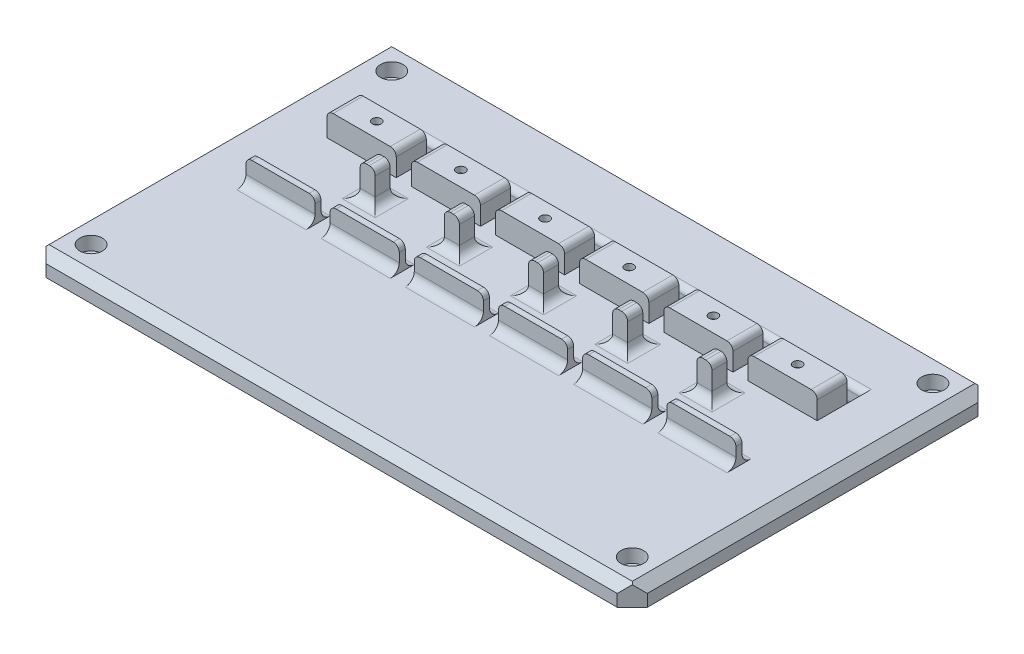
from build123d import *

# Parameters (mm, degrees)
SKETCH1_W           = 200
SKETCH1_H           = 120
BOSS_EXTRUDE1_DEPTH = 7
CHAMFER1_SIZE       = 5
SKETCH14_R          = 1.5
CUT_EXTRUDE13_DEPTH = 144.661892362
SKETCH16_R          = 3.75
CUT_EXTRUDE14_DEPTH = 4.5
SKETCH17_W          = 23
SKETCH17_H          = 10
SKETCH17_H_2        = 2
BOSS_EXTRUDE2_DEPTH = 8
FILLET1_R           = 3
SKETCH18_W          = 79
SKETCH18_H          = 6
CUT_EXTRUDE15_DEPTH = 144.714088791
SKETCH22_R          = 3.1
SKETCH22_R_2        = 3.5
CUT_EXTRUDE17_DEPTH = 13
SKETCH23_R          = 1.5
CUT_EXTRUDE18_DEPTH = 145.078934328
SKETCH24_W          = 5
SKETCH24_H          = 5
BOSS_EXTRUDE3_DEPTH = 11
FILLET2_R           = 3
FILLET3_R           = 3
FILLET4_R           = 2
FILLET5_R           = 2
FILLET6_R           = 2
FILLET7_R           = 2
CHAMFER2_SIZE       = 3


with BuildPart() as part:
    # Sketch1 → Boss-Extrude1 (new body)
    with BuildSketch(Plane(origin=(0, 0, 0), x_dir=(1, 0, 0), z_dir=(0, 1, 0))):
        with Locations((-11.182432432, 30.709459459)):
            Rectangle(SKETCH1_W, SKETCH1_H)
    extrude(amount=BOSS_EXTRUDE1_DEPTH)

    # Chamfer1
    chamfer1_edges = [part.edges().sort_by_distance(p)[0] for p in [
        (-111.182432432, 3.5, -90.709459459),
        (88.817567568, 3.5, -90.709459459),
        (88.817567568, 3.5, 29.290540541),
        (-111.182432432, 3.5, 29.290540541),
    ]]
    chamfer(chamfer1_edges, length=CHAMFER1_SIZE)

    # Sketch14 → Cut-Extrude13 (cut, through all)
    with BuildSketch(Plane.XZ):
        with Locations(Location((-101.182432432, 19.290540541, 0), (0, 0, 270))):
            Circle(SKETCH14_R)
        with Locations(Location((-101.182432432, -80.709459459, 0), (0, 0, 270))):
            Circle(SKETCH14_R)
        with Locations(Location((78.817567568, 19.290540541, 0), (0, 0, 270))):
            Circle(SKETCH14_R)
        with Locations(Location((78.817567568, -80.709459459, 0), (0, 0, 270))):
            Circle(SKETCH14_R)
    extrude(amount=-CUT_EXTRUDE13_DEPTH, mode=Mode.SUBTRACT)

    # Sketch16 → Cut-Extrude14 (cut)
    with BuildSketch(Plane.XZ.offset(-7)):
        with Locations(Location((-101.182432432, 19.290540541, 0), (0, 0, 270))):
            Circle(SKETCH16_R)
        with Locations(Location((78.817567568, 19.290540541, 0), (0, 0, 270))):
            Circle(SKETCH16_R)
        with Locations(Location((-101.182432432, -80.709459459, 0), (0, 0, 270))):
            Circle(SKETCH16_R)
        with Locations(Location((78.817567568, -80.709459459, 0), (0, 0, 270))):
            Circle(SKETCH16_R)
    extrude(amount=CUT_EXTRUDE14_DEPTH, mode=Mode.SUBTRACT)

    # Sketch17 → Boss-Extrude2 (add)
    with BuildSketch(Plane(origin=(0, 7, 0), x_dir=(1, 0, 0), z_dir=(0, 1, 0))):
        with Locations((-81.182432432, 55.709459459)):
            Rectangle(SKETCH17_W, SKETCH17_H)
        with Locations((-53.182432432, 55.709459459)):
            Rectangle(SKETCH17_W, SKETCH17_H)
        with Locations((-25.182432432, 55.709459459)):
            Rectangle(SKETCH17_W, SKETCH17_H)
        with Locations((2.817567568, 55.709459459)):
            Rectangle(SKETCH17_W, SKETCH17_H)
        with Locations((30.817567568, 55.709459459)):
            Rectangle(SKETCH17_W, SKETCH17_H)
        with Locations((58.817567568, 55.709459459)):
            Rectangle(SKETCH17_W, SKETCH17_H)
        with Locations((-81.182432432, 24.709459459)):
            Rectangle(SKETCH17_W, SKETCH17_H_2)
        with Locations((-53.182432432, 24.709459459)):
            Rectangle(SKETCH17_W, SKETCH17_H_2)
        with Locations((-25.182432432, 24.709459459)):
            Rectangle(SKETCH17_W, SKETCH17_H_2)
        with Locations((2.817567568, 24.709459459)):
            Rectangle(SKETCH17_W, SKETCH17_H_2)
        with Locations((30.817567568, 24.709459459)):
            Rectangle(SKETCH17_W, SKETCH17_H_2)
        with Locations((58.817567568, 24.709459459)):
            Rectangle(SKETCH17_W, SKETCH17_H_2)
    extrude(amount=BOSS_EXTRUDE2_DEPTH)

    # Fillet1
    fillet1_edges = [part.edges().sort_by_distance(p)[0] for p in [
        (-81.182432432, 7, -23.709459459),
        (-81.182432432, 7, -25.709459459),
        (-53.182432432, 7, -23.709459459),
        (-53.182432432, 7, -25.709459459),
        (-25.182432432, 7, -23.709459459),
        (-25.182432432, 7, -25.709459459),
        (2.817567568, 7, -23.709459459),
        (2.817567568, 7, -25.709459459),
        (30.817567568, 7, -23.709459459),
        (30.817567568, 7, -25.709459459),
        (58.817567568, 7, -23.709459459),
        (58.817567568, 7, -25.709459459),
    ]]
    fillet(fillet1_edges, radius=FILLET1_R)

    # Sketch18 → Cut-Extrude15 (cut, through all)
    with BuildSketch(Plane(origin=(0, 7, 0), x_dir=(1, 0, 0), z_dir=(0, 1, 0))):
        with Locations((-53.182432432, 63.709459459)):
            Rectangle(SKETCH18_W, SKETCH18_H)
        with Locations((30.817567568, 63.709459459)):
            Rectangle(SKETCH18_W, SKETCH18_H)
    extrude(amount=-CUT_EXTRUDE15_DEPTH, mode=Mode.SUBTRACT)

    # Sketch22 → Cut-Extrude17 (cut)
    with BuildSketch(Plane(origin=(0, 0, 0), x_dir=(1, 0, 0), z_dir=(0, 1, 0))):
        with Locations(Location((-81.182432432, 55.709459459, 0), (0, 0, 90))):
            Circle(SKETCH22_R)
        with Locations(Location((-53.182432432, 55.709459459, 0), (0, 0, 90))):
            Circle(SKETCH22_R)
        with Locations(Location((-25.182432432, 55.709459459, 0), (0, 0, 90))):
            Circle(SKETCH22_R_2)
        with Locations(Location((2.817567568, 55.709459459, 0), (0, 0, 90))):
            Circle(SKETCH22_R)
        with Locations(Location((30.817567568, 55.709459459, 0), (0, 0, 90))):
            Circle(SKETCH22_R)
        with Locations(Location((58.817567568, 55.709459459, 0), (0, 0, 90))):
            Circle(SKETCH22_R)
    extrude(amount=CUT_EXTRUDE17_DEPTH, mode=Mode.SUBTRACT)

    # Sketch23 → Cut-Extrude18 (cut, through all)
    with BuildSketch(Plane.XZ.offset(-13)):
        with Locations(Location((-81.182432432, -55.709459459, 0), (0, 0, 270))):
            Circle(SKETCH23_R)
        with Locations(Location((-53.182432432, -55.709459459, 0), (0, 0, 270))):
            Circle(SKETCH23_R)
        with Locations(Location((-25.182432432, -55.709459459, 0), (0, 0, 270))):
            Circle(SKETCH23_R)
        with Locations(Location((2.817567568, -55.709459459, 0), (0, 0, 270))):
            Circle(SKETCH23_R)
        with Locations(Location((30.817567568, -55.709459459, 0), (0, 0, 270))):
            Circle(SKETCH23_R)
        with Locations(Location((58.817567568, -55.709459459, 0), (0, 0, 270))):
            Circle(SKETCH23_R)
    extrude(amount=-CUT_EXTRUDE18_DEPTH, mode=Mode.SUBTRACT)

    # Sketch24 → Boss-Extrude3 (add)
    with BuildSketch(Plane(origin=(0, 7, 0), x_dir=(1, 0, 0), z_dir=(0, 1, 0))):
        with Locations((-67.182432432, 41.209459459)):
            Rectangle(SKETCH24_W, SKETCH24_H)
        with Locations((-39.182432432, 41.209459459)):
            Rectangle(SKETCH24_W, SKETCH24_H)
        with Locations((-11.182432432, 41.209459459)):
            Rectangle(SKETCH24_W, SKETCH24_H)
        with Locations((16.817567568, 41.209459459)):
            Rectangle(SKETCH24_W, SKETCH24_H)
        with Locations((44.817567568, 41.209459459)):
            Rectangle(SKETCH24_W, SKETCH24_H)
    extrude(amount=BOSS_EXTRUDE3_DEPTH)

    # Fillet2
    fillet2_edges = [part.edges().sort_by_distance(p)[0] for p in [
        (-69.682432432, 7, -41.209459459),
        (-64.682432432, 7, -41.209459459),
        (-41.682432432, 7, -41.209459459),
        (-36.682432432, 7, -41.209459459),
        (-13.682432432, 7, -41.209459459),
        (-8.682432432, 7, -41.209459459),
        (14.317567568, 7, -41.209459459),
        (19.317567568, 7, -41.209459459),
        (42.317567568, 7, -41.209459459),
        (47.317567568, 7, -41.209459459),
    ]]
    fillet(fillet2_edges, radius=FILLET2_R)

    # Fillet3
    fillet3_edges = [part.edges().sort_by_distance(p)[0] for p in [
        (-39.182432432, 7, -38.709459459),
        (-67.182432432, 7, -38.709459459),
        (44.817567568, 7, -43.709459459),
        (16.817567568, 7, -43.709459459),
        (-11.182432432, 7, -43.709459459),
        (-39.182432432, 7, -43.709459459),
        (-67.182432432, 7, -43.709459459),
        (44.817567568, 7, -38.709459459),
        (16.817567568, 7, -38.709459459),
        (-11.182432432, 7, -38.709459459),
    ]]
    fillet(fillet3_edges, radius=FILLET3_R)

    # Fillet4
    fillet4_edges = [part.edges().sort_by_distance(p)[0] for p in [
        (-69.682432432, 18, -41.209459459),
        (-64.682432432, 18, -41.209459459),
        (-41.682432432, 18, -41.209459459),
        (-36.682432432, 18, -41.209459459),
        (-13.682432432, 18, -41.209459459),
        (-8.682432432, 18, -41.209459459),
        (14.317567568, 18, -41.209459459),
        (19.317567568, 18, -41.209459459),
        (42.317567568, 18, -41.209459459),
        (47.317567568, 18, -41.209459459),
    ]]
    fillet(fillet4_edges, radius=FILLET4_R)

    # Fillet5
    fillet5_edges = [part.edges().sort_by_distance(p)[0] for p in [
        (-53.182432432, 7, -66.709459459),
        (30.817567568, 7, -66.709459459),
    ]]
    fillet(fillet5_edges, radius=FILLET5_R)

    # Fillet6
    fillet6_edges = [part.edges().sort_by_distance(p)[0] for p in [
        (-53.182432432, 0, -66.709459459),
        (-13.682432432, 0, -63.709459459),
        (-8.682432432, 0, -63.709459459),
        (30.817567568, 0, -66.709459459),
    ]]
    fillet(fillet6_edges, radius=FILLET6_R)

    # Fillet7
    fillet7_edges = [part.edges().sort_by_distance(p)[0] for p in [
        (-36.682432432, 15, -55.709459459),
        (-13.682432432, 15, -55.709459459),
        (-8.682432432, 15, -55.709459459),
        (14.317567568, 15, -55.709459459),
        (19.317567568, 15, -55.709459459),
        (42.317567568, 15, -55.709459459),
        (47.317567568, 15, -55.709459459),
        (70.317567568, 15, -55.709459459),
        (-92.682432432, 15, -24.709459459),
        (-69.682432432, 15, -24.709459459),
        (-64.682432432, 15, -24.709459459),
        (-41.682432432, 15, -24.709459459),
        (-36.682432432, 15, -24.709459459),
        (-13.682432432, 15, -24.709459459),
        (-8.682432432, 15, -24.709459459),
        (14.317567568, 15, -24.709459459),
        (19.317567568, 15, -24.709459459),
        (42.317567568, 15, -24.709459459),
        (47.317567568, 15, -24.709459459),
        (70.317567568, 15, -24.709459459),
        (-92.682432432, 15, -55.709459459),
        (-69.682432432, 15, -55.709459459),
        (-64.682432432, 15, -55.709459459),
        (-41.682432432, 15, -55.709459459),
    ]]
    fillet(fillet7_edges, radius=FILLET7_R)

    # Chamfer2
    # the kernel refuses this chamfer: 3 mm, written as the material it takes off along each edge
    with BuildSketch(Plane(origin=(88.817567568, 7, 32.005589504), x_dir=(-0.9996219169112968, 0.02749587661058648, 0), z_dir=(0, 0, -1)), Plane(origin=(-111.182432432, 7, -93.424508423), x_dir=(0.9996219169112968, 0.02749587661058648, 0), z_dir=(0, 0, 1))) as chamfer2_piece_1:
        Polygon((CHAMFER2_SIZE * 0.999621916911, -CHAMFER2_SIZE * 0.0274958766106), (-CHAMFER2_SIZE * 0.0274958766106, -CHAMFER2_SIZE * 0.999621916911), (0, 0), align=None)
    extrude(amount=125.430097928, mode=Mode.SUBTRACT)
    with BuildSketch(Plane(origin=(91.532616531, 7, -90.709459459), x_dir=(0, 0.02749587661058648, 0.9996219169112968), z_dir=(-1, 0, 0)), Plane(origin=(-113.897481396, 7, 29.290540541), x_dir=(0, 0.02749587661058648, -0.9996219169112968), z_dir=(1, 0, 0))) as chamfer2_piece_2:
        Polygon((CHAMFER2_SIZE * 0.999621916911, -CHAMFER2_SIZE * 0.0274958766106), (-CHAMFER2_SIZE * 0.0274958766106, -CHAMFER2_SIZE * 0.999621916911), (0, 0), align=None)
    extrude(amount=205.430097928, mode=Mode.SUBTRACT)


solid = part.part
